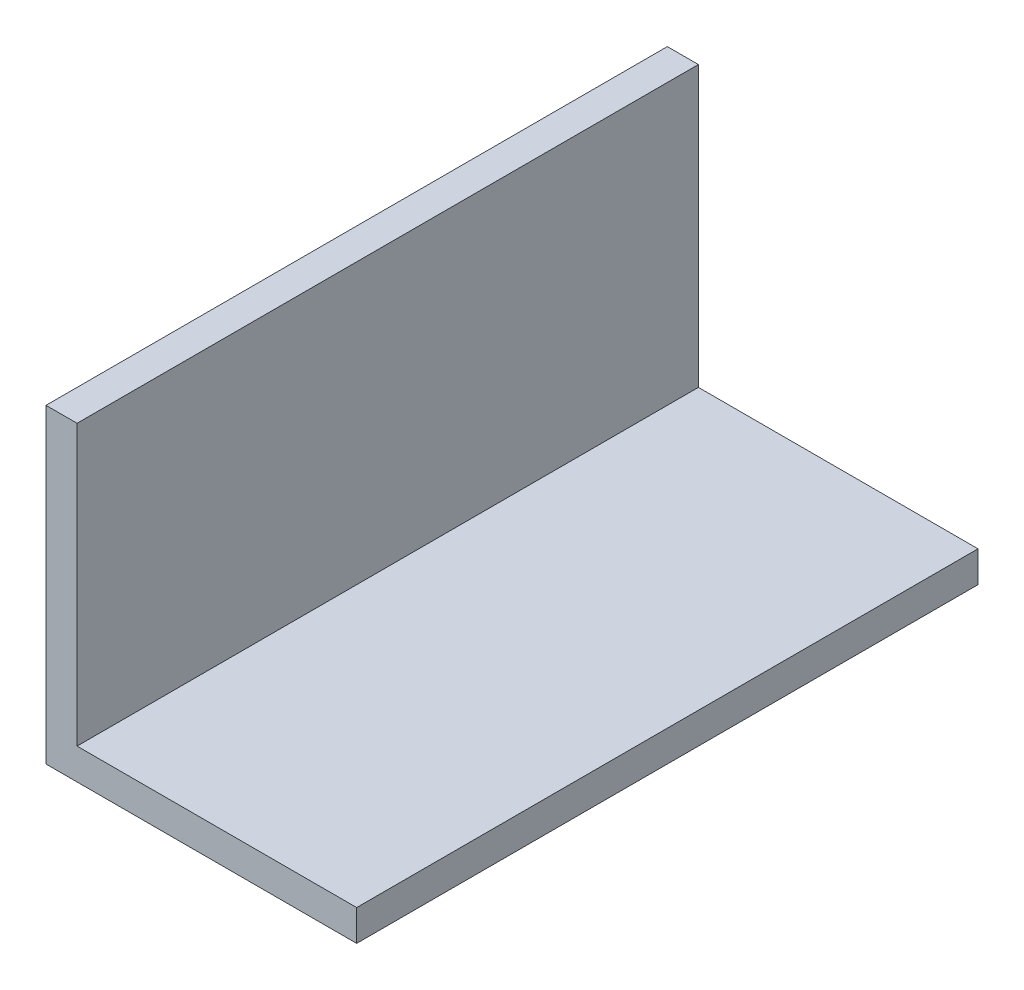
from build123d import *

# Parameters (mm, degrees)
EXTRUDE_1_DEPTH = 60


with BuildPart() as part:
    # Эскиз1 → Бобышка-Вытянуть1 (new body)
    with BuildSketch(Plane.XY):
        Polygon((0, 30), (0, 0), (30, 0), (30, 3), (3, 3), (3, 30), align=None)
    extrude(amount=EXTRUDE_1_DEPTH)


solid = part.part
